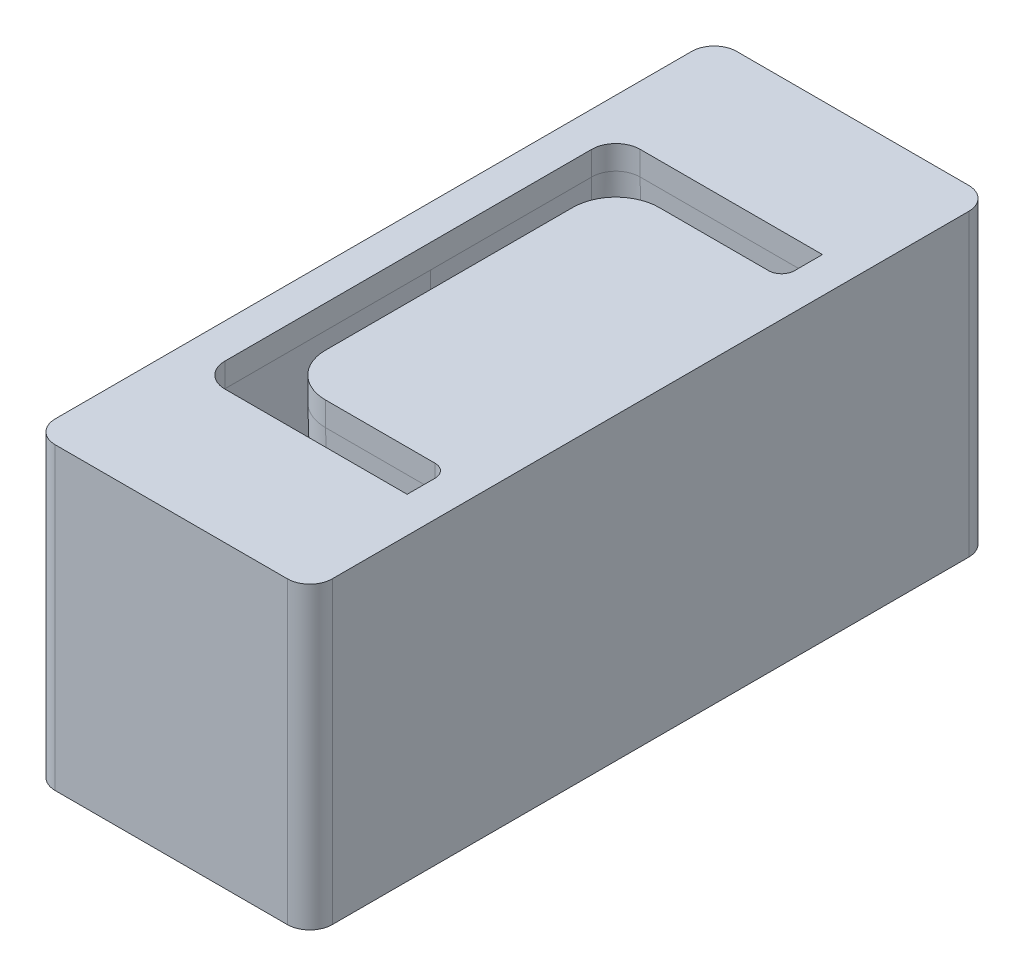
from build123d import *

# Parameters (mm, degrees)
SKETCH1_W             = 37
SKETCH1_H             = 91
BOSS_EXTRUDE1_DEPTH   = 40
FILLET1_R             = 3
CUT_EXTRUDE1_REACH    = 71.233
M8_TAPPED_HOLE1_D     = 6.8
M8_TAPPED_HOLE1_DEPTH = 22.25
M8_TAPPED_HOLE1_TIP   = 2.042926105


with BuildPart() as part:
    # Sketch1 → Boss-Extrude1 (new body)
    with BuildSketch(Plane(origin=(0, 0, 0), x_dir=(1, 0, 0), z_dir=(0, 1, 0))):
        with Locations((10.5, -3)):
            Rectangle(SKETCH1_W, SKETCH1_H)
    extrude(amount=-BOSS_EXTRUDE1_DEPTH)

    # Fillet1
    fillet1_edges = [part.edges().sort_by_distance(p)[0] for p in [
        (-8, -20, -42.5),
        (29, -20, -42.5),
        (29, -20, 48.5),
        (-8, -20, 48.5),
    ]]
    fillet(fillet1_edges, radius=FILLET1_R)

    # Sketch2 → Cut-Extrude1 (cut, up to next)
    with BuildSketch(Plane(origin=(0, 0, 0), x_dir=(1, 0, 0), z_dir=(0, 1, 0)), mode=Mode.PRIVATE) as cut_extrude1_sk1:
        with BuildLine():
            Line((24.23, 24.73), (-0.12, 24.73))
            ThreePointArc((-0.12, 24.73), (-2.403954903, 23.783954903), (-3.35, 21.5))
            Line((-3.35, 21.5), (-3.35, -27.5))
            ThreePointArc((-3.35, -27.5), (-2.403954903, -29.783954903), (-0.12, -30.73))
            Line((-0.12, -30.73), (24.23, -30.73))
            Line((24.23, -30.73), (24.23, -27))
            ThreePointArc((24.23, -27), (23.723294731, -25.776705269), (22.5, -25.27))
            Line((22.5, -25.27), (7.88, -25.27))
            ThreePointArc((7.88, -25.27), (3.799993873, -23.580006127), (2.11, -19.5))
            Line((2.11, -19.5), (2.11, 13.5))
            ThreePointArc((2.11, 13.5), (3.799993873, 17.580006127), (7.88, 19.27))
            Line((7.88, 19.27), (22.5, 19.27))
            ThreePointArc((22.5, 19.27), (23.723294731, 19.776705269), (24.23, 21))
            Line((24.23, 21), (24.23, 24.73))
        make_face()
    cut_extrude1_tool1 = extrude(cut_extrude1_sk1.sketch, amount=-CUT_EXTRUDE1_REACH, mode=Mode.PRIVATE) & part.part
    add(cut_extrude1_tool1.solids().sort_by_distance((1.490608, 0, 3))[0], mode=Mode.SUBTRACT)

    # Cut-Sweep1: sweep along a path in Sketch4
    with BuildLine(Plane(origin=(0, 0, 0), x_dir=(1, 0, 0), z_dir=(0, 1, 0))) as cut_sweep1_path:
        Line((24.23, 21), (24.23, 24.73))
        Line((24.23, 24.73), (-0.12, 24.73))
        ThreePointArc((-0.12, 24.73), (-2.403954903, 23.783954903), (-3.35, 21.5))
        Line((-3.35, 21.5), (-3.35, -27.5))
        ThreePointArc((-3.35, -27.5), (-2.403954903, -29.783954903), (-0.12, -30.73))
        Line((-0.12, -30.73), (24.23, -30.73))
        Line((24.23, -30.73), (24.23, -27))
        ThreePointArc((24.23, -27), (23.723294731, -25.776705269), (22.5, -25.27))
        Line((22.5, -25.27), (7.88, -25.27))
        ThreePointArc((7.88, -25.27), (3.799993873, -23.580006127), (2.11, -19.5))
        Line((2.11, -19.5), (2.11, 13.5))
        ThreePointArc((2.11, 13.5), (3.799993873, 17.580006127), (7.88, 19.27))
        Line((7.88, 19.27), (22.5, 19.27))
        ThreePointArc((22.5, 19.27), (23.723294731, 19.776705269), (24.23, 21))
    # Sketch3 → Cut-Sweep1 (sweep, cut)
    with BuildSketch(Plane.XY):
        Polygon((-3.35, -3.2), (-3.992346389, -40), (-3.35, -40), align=None)
    sweep(path=cut_sweep1_path.line, transition=Transition.RIGHT, mode=Mode.SUBTRACT)

    # M8 Tapped Hole1
    with Locations(Plane(origin=(0, -40, 0), x_dir=(-1, 0, 0), z_dir=(0, -1, 0))):
        with Locations((-10.5, 33.936173195), (-10.5, -39.936173195)):
            Hole(M8_TAPPED_HOLE1_D / 2, depth=M8_TAPPED_HOLE1_DEPTH)
            with Locations((0, 0, -(M8_TAPPED_HOLE1_DEPTH + M8_TAPPED_HOLE1_TIP / 2))):  # 118° drill point
                Cone(0, M8_TAPPED_HOLE1_D / 2, M8_TAPPED_HOLE1_TIP, mode=Mode.SUBTRACT)


solid = part.part
